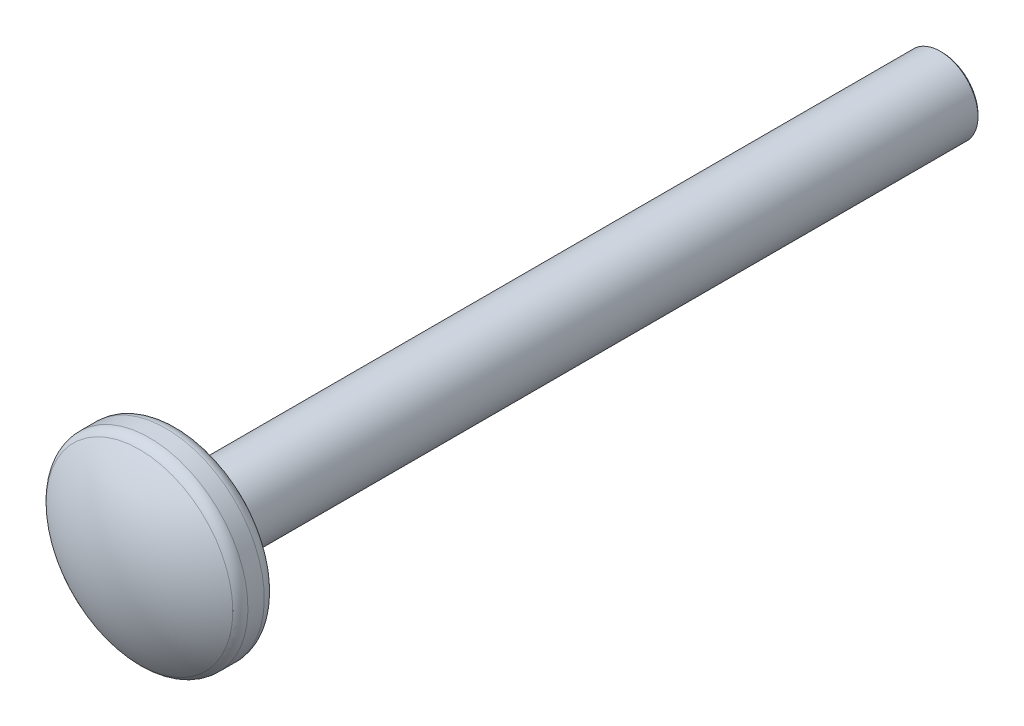
from build123d import *

# Parameters (mm, degrees)
SKETCH3_W          = 31.75
SKETCH3_H          = 1.567244252
SKETCH38_OUTSIDE_W = 77.2
SKETCH38_OUTSIDE_H = 77.2
SKETCH38_OUTSIDE_R = 1.4874875
EXTRUDE6_DEPTH     = 32.827268326
EXTRUDE6_DRAFT     = -45
SKETCH8_W          = 2.921
SKETCH8_H          = 4.0894
SKETCH21_R         = 2.690784338
SKETCH21_R_2       = 1.567244252
EXTRUDE2_DEPTH     = 0.5842


with BuildPart() as part:
    # Sketch3 → Revolve1 (revolve)
    with BuildSketch(Plane(origin=(0, 0, 0), x_dir=(0, 0, -1), z_dir=(1, 0, 0))):
        with Locations((-15.875, 0.783622126)):
            Rectangle(SKETCH3_W, SKETCH3_H)
    revolve(axis=Axis((0, 0, 0), (0, 0, 1)))


with BuildPart() as extrude6_tool:
    # Sketch38 outside → Extrude6 (with draft: the straight prism first)
    with BuildSketch(Plane(origin=(0, 0, 0), x_dir=(-1, 0, 0), z_dir=(0, 0, -1))):
        Rectangle(SKETCH38_OUTSIDE_W, SKETCH38_OUTSIDE_H)
        Circle(SKETCH38_OUTSIDE_R, mode=Mode.SUBTRACT)
    extrude(amount=-EXTRUDE6_DEPTH)
    # Extrude6: the draft: its side faces are tilted about the plane it starts from
    extrude6_sides = [extrude6_tool.faces().sort_by_distance(p)[0] for p in [
        (0, -38.6, 16.413634163),
        (-38.6, 0, 16.413634163),
        (0, 38.6, 16.413634163),
        (38.6, 0, 16.413634163),
        (1.4874875, 0, 16.413634163),
    ]]
    draft(extrude6_sides, Plane(origin=(0, 0, 0), x_dir=(-1, 0, 0), z_dir=(0, 0, -1)), EXTRUDE6_DRAFT)


with BuildPart() as part_1:
    add(part.part)

    # Extrude6: cut by extrude6_tool
    add(extrude6_tool.part, mode=Mode.SUBTRACT)

    # Sketch8 → Revolve2 (revolve)
    with BuildSketch(Plane(origin=(0, 0, 0), x_dir=(0, 0, -1), z_dir=(1, 0, 0))):
        with Locations((-33.2105, 2.0447)):
            Rectangle(SKETCH8_W, SKETCH8_H)
    revolve(axis=Axis((0, 0, 0), (0, 0, 1)))

    # Sketch11 → Cut-Revolve3 (revolve, cut)
    with BuildSketch(Plane(origin=(0, 0, 0), x_dir=(0, 0, -1), z_dir=(1, 0, 0))):
        with BuildLine():
            Line((-32.954906874, 4.0894), (-32.27578, 4.0894))
            ThreePointArc((-32.27578, 4.0894), (-31.903997397, 3.935402603), (-31.75, 3.56362))
            Line((-31.75, 3.56362), (-31.115, 3.56362))
            Line((-31.115, 3.56362), (-31.115, 4.7244))
            Line((-31.115, 4.7244), (-35.306, 4.7244))
            Line((-35.306, 4.7244), (-35.306, 0))
            Line((-35.306, 0), (-34.671, 0))
            ThreePointArc((-34.671, 0), (-34.338470898, 2.045152261), (-33.375141868, 3.87960601))
            ThreePointArc((-33.375141868, 3.87960601), (-33.189753083, 4.034036694), (-32.954906874, 4.0894))
        make_face()
    revolve(axis=Axis((0, 0, 34.671), (0, 0, -1)), mode=Mode.SUBTRACT)


with BuildPart() as body_2:
    # Sketch21 → Extrude2 (new body)
    with BuildSketch(Plane.XY.offset(31.593869553)):
        Circle(SKETCH21_R)
        Circle(SKETCH21_R_2, mode=Mode.SUBTRACT)
    extrude(amount=-EXTRUDE2_DEPTH)


solid = Compound([part_1.part, body_2.part])
